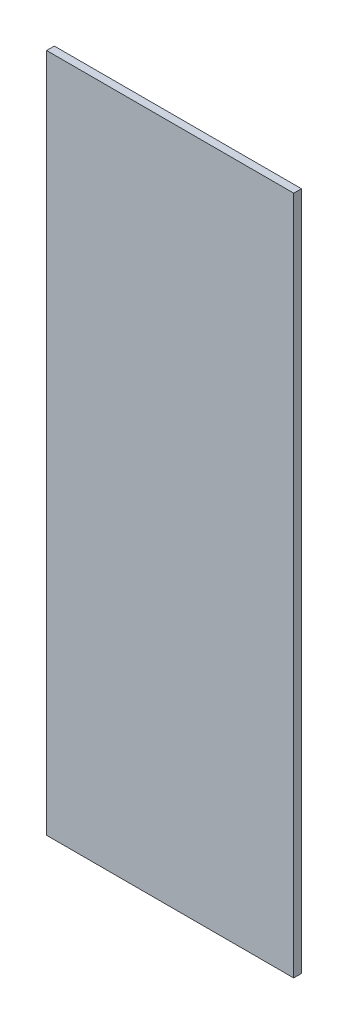
from build123d import *

# Parameters (mm, degrees)
SKETCH1_W           = 50.8
SKETCH1_H           = 139.7
BOSS_EXTRUDE1_DEPTH = 1.5875


with BuildPart() as part:
    # Sketch1 → Boss-Extrude1 (new body)
    with BuildSketch(Plane.XY):
        with Locations((25.4, 69.85)):
            Rectangle(SKETCH1_W, SKETCH1_H)
    extrude(amount=BOSS_EXTRUDE1_DEPTH)


solid = part.part
